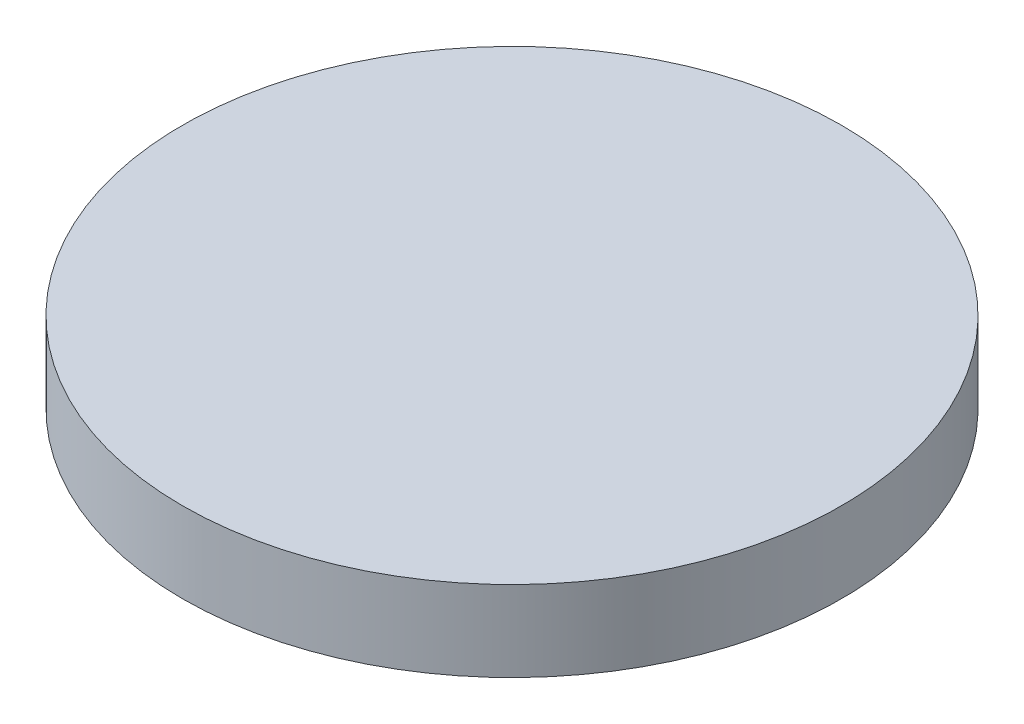
from build123d import *

# Parameters (mm, degrees)
SKETCH_1_R      = 45
EXTRUDE_1_DEPTH = 6
EXTRUDE_START   = 5
SKETCH_2_R      = 45
SKETCH_2_R_2    = 40
EXTRUDE_2_DEPTH = 5


with BuildPart() as part:
    # Эскиз1 → Бобышка-Вытянуть1 (new body)
    with BuildSketch(Plane(origin=(0, 0, 0), x_dir=(1, 0, 0), z_dir=(0, 1, 0))):
        Circle(SKETCH_1_R)
    extrude(amount=EXTRUDE_1_DEPTH)

    # Эскиз2 → Бобышка-Вытянуть2 (add)
    with BuildSketch(Plane.XZ.offset(EXTRUDE_START)):
        Circle(SKETCH_2_R)
        Circle(SKETCH_2_R_2, mode=Mode.SUBTRACT)
    extrude(amount=-EXTRUDE_2_DEPTH)


solid = part.part
